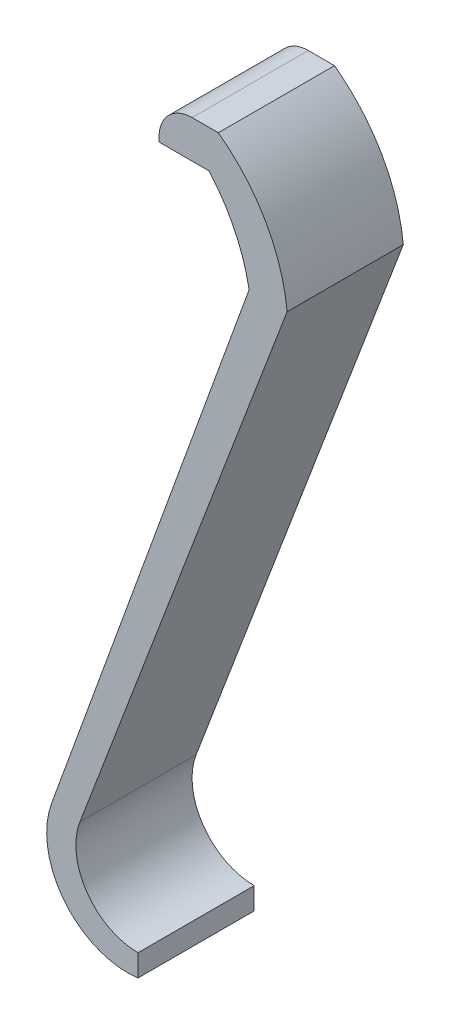
from build123d import *

# Parameters (mm, degrees)
ESTRUSIONE_ESTRUSIONE2_DEPTH = 6
SMUSSO1_SIZE                 = 1
RACCORDO5_R                  = 1.707107


# Read off the part's stored shape, not the designer's step: Estrusione-Estrusione2
with BuildPart() as part:
    # Estrusione-Estrusione2 outline → Estrusione-Estrusione2 (new body)
    with BuildSketch(Plane.XY):
        with BuildLine():
            Line((-54.136250947, 19.470330923), (-54.136250947, 17.522149798))
            Line((-54.136250947, 17.522149798), (-51.559423685, 17.522149798))
            ThreePointArc((-51.559423685, 17.522149798), (-50.228448587, 15.523864916), (-49.484742197, 13.240985597))
            Line((-49.484742197, 13.240985597), (-59.687524076, -14.833797153))
            ThreePointArc((-59.687524076, -14.833797153), (-59.02122155, -18.875711178), (-55.222335236, -20.408516065))
            Line((-55.222335236, -20.408516065), (-55.222335236, -19.277551448))
            ThreePointArc((-55.222335236, -19.277551448), (-57.864636062, -17.890294899), (-58.223117797, -14.927572295))
            Line((-58.223117797, -14.927572295), (-47.522213123, 13.240985597))
            ThreePointArc((-47.522213123, 13.240985597), (-48.637151321, 16.732148519), (-51.073062414, 19.470330923))
            Line((-51.073062414, 19.470330923), (-54.136250947, 19.470330923))
        make_face()
    extrude(amount=ESTRUSIONE_ESTRUSIONE2_DEPTH)

    # Smusso1
    smusso1_edges = [part.edges().sort_by_distance(p)[0] for p in [
        (-54.136250947, 19.470330923, 3),
    ]]
    chamfer(smusso1_edges, length=SMUSSO1_SIZE)

    # Raccordo5
    raccordo5_edges = [part.edges().sort_by_distance(p)[0] for p in [
        (-54.136250947, 18.470330923, 3),
        (-53.136250947, 19.470330923, 3),
    ]]
    fillet(raccordo5_edges, radius=RACCORDO5_R - 0.0001)  # a hair under: the kernel refuses the full size


solid = part.part
